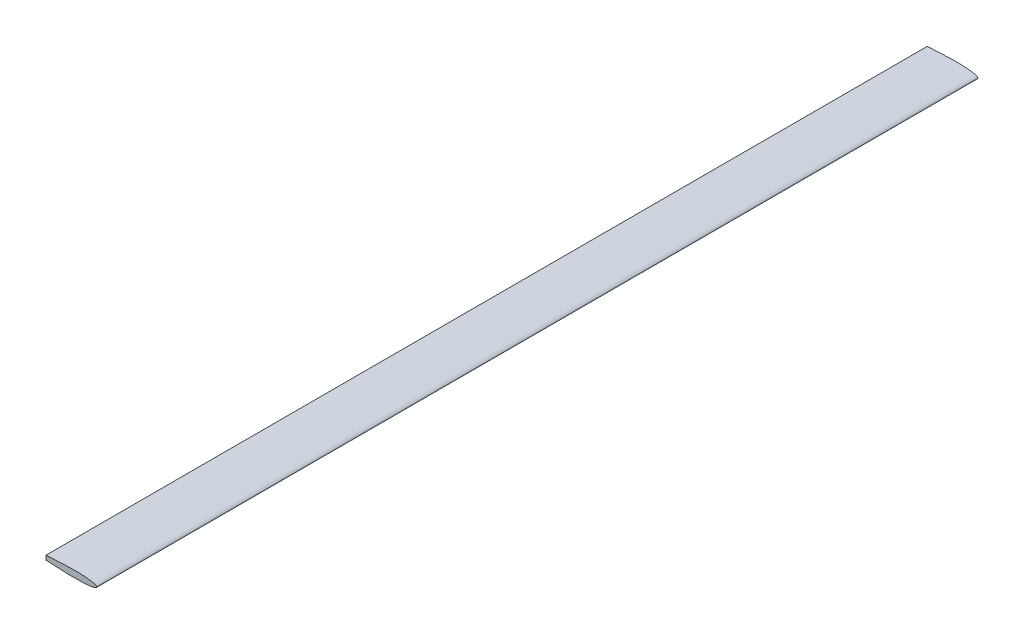
from build123d import *

# Parameters (mm, degrees)
BOSS_EXTRUDE1_DEPTH = 446.4


with BuildPart() as part:
    # Sketch1 → Boss-Extrude1 (new, symmetric)
    with BuildSketch(Plane.XY):
        with BuildLine():
            Line((-51.40868, 2.183767053), (-51.40868, -2.183767053))
            add(Edge.make_bspline(
                [(-51.40868, 2.183767053), (-50.766320595, 2.229698797), (-48.850567772, 2.366684211), (-45.631675962, 2.574113725), (-41.738105661, 2.804346238), (-37.801297891, 3.007295279), (-33.864456216, 3.176881874), (-29.970657626, 3.305395437), (-26.162535975, 3.386035657), (-22.481774642, 3.412769642), (-18.968661752, 3.380938287), (-15.661633669, 3.287630869), (-12.596859563, 3.131957942), (-9.807740267, 2.915286305), (-7.324695015, 2.640851266), (-5.173956138, 2.314584731), (-3.379002683, 1.94156629), (-1.9529753, 1.534616077), (-0.911130738, 1.087814172), (-0.217073547, 0.626211153), (0.089744143, 0), (-0.217073547, -0.626211153), (-0.911130738, -1.087814172), (-1.9529753, -1.534616077), (-3.379002683, -1.94156629), (-5.173956138, -2.314584731), (-7.324695015, -2.640851266), (-9.807740267, -2.915286305), (-12.596859563, -3.131957942), (-15.661633669, -3.287630869), (-18.968661752, -3.380938287), (-22.481774642, -3.412769642), (-26.162535975, -3.386035657), (-29.970657626, -3.305395437), (-33.864456216, -3.176881874), (-37.801297891, -3.007295279), (-41.738105661, -2.804346238), (-45.631675962, -2.574113725), (-48.850567772, -2.366684211), (-50.766320595, -2.229698797), (-51.40868, -2.183767053)],
                knots=[0, 0, 0, 0, 0.018499199, 0.055171439, 0.092655195, 0.130538861, 0.168407204, 0.205846372, 0.242448967, 0.277819055, 0.311576982, 0.343363918, 0.372846133, 0.39971914, 0.423712133, 0.444593591, 0.462180115, 0.476353861, 0.487105625, 0.494669113, 0.5, 0.505330887, 0.512894375, 0.523646139, 0.537819885, 0.555406409, 0.576287867, 0.60028086, 0.627153867, 0.656636082, 0.688423018, 0.722180945, 0.757551033, 0.794153628, 0.831592796, 0.869461139, 0.907344805, 0.944828561, 0.981500801, 1, 1, 1, 1], degree=3))
        make_face()
    extrude(amount=BOSS_EXTRUDE1_DEPTH, both=True)


solid = part.part
